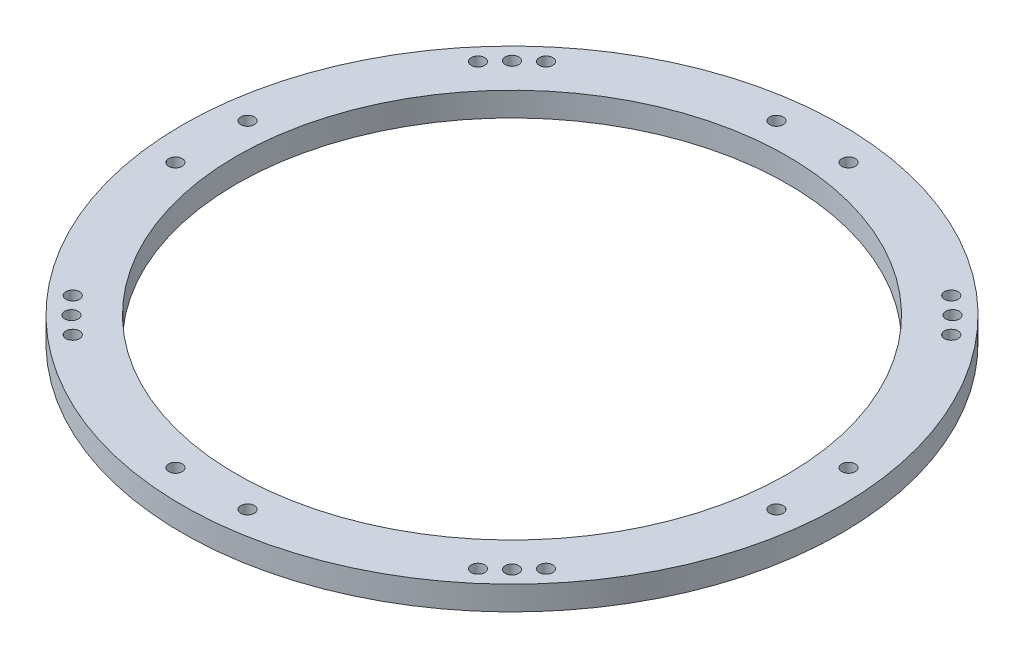
from build123d import *

# Parameters (mm, degrees)
SKETCH1_W                       = 28.575
SKETCH1_H                       = 12.7
F_9_32_0_28125_DIAMETER_HOLE1_D = 7.14375
SKETCH7_R                       = 3.571875
CUT_EXTRUDE1_DEPTH              = 247.543645639
CIRPATTERN1_COUNT               = 4


with BuildPart() as part:
    # Sketch1 → Revolve1 (revolve)
    with BuildSketch(Plane.XY):
        with Locations((159.813733777, 201.018503093)):
            Rectangle(SKETCH1_W, SKETCH1_H)
    revolve(axis=Axis((1e-09, -200000, 0), (0, 1, 0)))

    # 9/32 (0.28125) Diameter Hole1 (through all)
    with Locations(Plane(origin=(0, 207.368503093, 0), x_dir=(1, 0, 0), z_dir=(0, 1, 0))):
        with Locations((-116.372970926, 116.372970926), (-107.045703742, 125.006215984), (-125.006215984, 107.045703742)):
            f_9_32_0_28125_diameter_hole1 = Hole(F_9_32_0_28125_DIAMETER_HOLE1_D / 2)

    # Sketch7 → Cut-Extrude1 (cut, through all)
    with BuildSketch(Plane(origin=(0, 207.368503093, 0), x_dir=(1, 0, 0), z_dir=(0, 1, 0))):
        with Locations((158.75, -19.05)):
            Circle(SKETCH7_R)
        with Locations((158.75, 19.05)):
            Circle(SKETCH7_R)
    cut_extrude1 = extrude(amount=-CUT_EXTRUDE1_DEPTH, mode=Mode.SUBTRACT)

    # CirPattern1: 9/32 (0.28125) Diameter Hole1, Cut-Extrude1 ×4 about axis
    cirpattern1_axis = Axis((1e-09, -200000, 0), (0, -1, 0))
    add([f_9_32_0_28125_diameter_hole1.rotate(cirpattern1_axis, i * 360 / CIRPATTERN1_COUNT) for i in range(1, CIRPATTERN1_COUNT)], mode=Mode.SUBTRACT)
    add([cut_extrude1.rotate(cirpattern1_axis, i * 360 / CIRPATTERN1_COUNT) for i in range(1, CIRPATTERN1_COUNT)], mode=Mode.SUBTRACT)


solid = part.part
